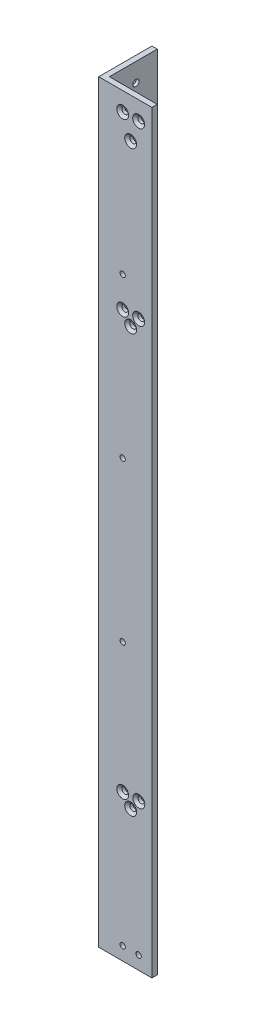
from build123d import *

# Parameters (mm, degrees)
BOSS_EXTRUDE1_DEPTH                               = 450
BACKSIDEHOLES_SKETCH3_R                           = 1.5875
BACKSIDEHOLES_CUT_EXTRUDE1_DEPTH                  = 3.175
RIGHTSIDEHOLES_CUT_EXTRUDE2_OUTLINE_R             = 1.5875
RIGHTSIDEHOLES_CUT_EXTRUDE2_DEPTH                 = 3.175
CSK_FOR_6_FLAT_HEAD_MACHINE_SCREW_100_D           = 3.7973
CSK_FOR_6_FLAT_HEAD_MACHINE_SCREW_100_CSINK_D     = 7.0866
CSK_FOR_6_FLAT_HEAD_MACHINE_SCREW_100_CSINK_ANGLE = 100
CSK_FOR_6_FLAT_HEAD_MACHINE_SCREW_2_D             = 3.7973
CSK_FOR_6_FLAT_HEAD_MACHINE_SCREW_2_CSINK_D       = 7.0866
CSK_FOR_6_FLAT_HEAD_MACHINE_SCREW_2_CSINK_ANGLE   = 100


# Read off the part's stored shape, not the designer's step: RightSideHoles-Cut-Extrude2
with BuildPart() as part:
    # Sketch2 → Boss-Extrude1 (new body)
    with BuildSketch(Plane(origin=(0, 0, 0), x_dir=(1, 0, 0), z_dir=(0, 1, 0))):
        Polygon((0, 31.75), (3.175, 31.75), (3.175, 3.175), (31.75, 3.175), (31.75, 0), (0, 0), align=None)
    extrude(amount=BOSS_EXTRUDE1_DEPTH)

    # BackSideHoles-Sketch3 → BackSideHoles-Cut-Extrude1 (cut)
    with BuildSketch(Plane.XY):
        with Locations((19.05, 81.1125)):
            Circle(BACKSIDEHOLES_SKETCH3_R)
        with Locations((14.2875, 87.4625)):
            Circle(BACKSIDEHOLES_SKETCH3_R)
        with Locations((23.933174186, 87.4625)):
            Circle(BACKSIDEHOLES_SKETCH3_R)
        with Locations((14.2875, 438.8875)):
            Circle(BACKSIDEHOLES_SKETCH3_R)
        with Locations((23.8125, 438.8875)):
            Circle(BACKSIDEHOLES_SKETCH3_R)
        with Locations((19.05, 426.1875)):
            Circle(BACKSIDEHOLES_SKETCH3_R)
        with Locations((14.2875, 336.74737)):
            Circle(BACKSIDEHOLES_SKETCH3_R)
        with Locations((23.8125, 336.74737)):
            Circle(BACKSIDEHOLES_SKETCH3_R)
        with Locations((19.05, 330.39737)):
            Circle(BACKSIDEHOLES_SKETCH3_R)
        with Locations((14.2875, 165)):
            Circle(BACKSIDEHOLES_SKETCH3_R)
        with Locations((14.2875, 260)):
            Circle(BACKSIDEHOLES_SKETCH3_R)
        with Locations((14.2875, 7.9375)):
            Circle(BACKSIDEHOLES_SKETCH3_R)
        with Locations((23.8125, 7.9375)):
            Circle(BACKSIDEHOLES_SKETCH3_R)
        with Locations((14.2875, 355)):
            Circle(BACKSIDEHOLES_SKETCH3_R)
    extrude(amount=-BACKSIDEHOLES_CUT_EXTRUDE1_DEPTH, mode=Mode.SUBTRACT)

    # RightSideHoles-Cut-Extrude2 outline → RightSideHoles-Cut-Extrude2 (cut)
    with BuildSketch(Plane.YZ):
        with Locations((81.1125, -23.8125)):
            Circle(RIGHTSIDEHOLES_CUT_EXTRUDE2_OUTLINE_R)
        with Locations((306.32237, -23.8125)):
            Circle(RIGHTSIDEHOLES_CUT_EXTRUDE2_OUTLINE_R)
        with Locations((341.24737, -14.2875)):
            Circle(RIGHTSIDEHOLES_CUT_EXTRUDE2_OUTLINE_R)
        with Locations((341.24737, -23.8125)):
            Circle(RIGHTSIDEHOLES_CUT_EXTRUDE2_OUTLINE_R)
        with Locations((165, -14.2875)):
            Circle(RIGHTSIDEHOLES_CUT_EXTRUDE2_OUTLINE_R)
        with Locations((306.32237, -14.2875)):
            Circle(RIGHTSIDEHOLES_CUT_EXTRUDE2_OUTLINE_R)
        with Locations((260, -14.2875)):
            Circle(RIGHTSIDEHOLES_CUT_EXTRUDE2_OUTLINE_R)
        with Locations((81.1125, -14.2875)):
            Circle(RIGHTSIDEHOLES_CUT_EXTRUDE2_OUTLINE_R)
        with Locations((87.4625, -19.05)):
            Circle(RIGHTSIDEHOLES_CUT_EXTRUDE2_OUTLINE_R)
        with Locations((355, -14.2875)):
            Circle(RIGHTSIDEHOLES_CUT_EXTRUDE2_OUTLINE_R)
        with Locations((438.8875, -19.05)):
            Circle(RIGHTSIDEHOLES_CUT_EXTRUDE2_OUTLINE_R)
        with Locations((426.1875, -14.2875)):
            Circle(RIGHTSIDEHOLES_CUT_EXTRUDE2_OUTLINE_R)
        with Locations((426.1875, -23.8125)):
            Circle(RIGHTSIDEHOLES_CUT_EXTRUDE2_OUTLINE_R)
        with Locations((7.9375, -23.8125)):
            Circle(RIGHTSIDEHOLES_CUT_EXTRUDE2_OUTLINE_R)
        with Locations((7.9375, -14.2875)):
            Circle(RIGHTSIDEHOLES_CUT_EXTRUDE2_OUTLINE_R)
    extrude(amount=RIGHTSIDEHOLES_CUT_EXTRUDE2_DEPTH, mode=Mode.SUBTRACT)

    # CSK for _6 Flat Head Machine Screw _100 (through all)
    with Locations(Plane.ZY):
        with Locations((-23.8125, 81.1125), (-19.05, 87.4625), (-14.2875, 81.1125), (-23.8125, 341.24737), (-14.2875, 341.24737), (-23.8125, 306.32237), (-14.2875, 306.32237), (-23.8125, 426.1875), (-14.2875, 426.1875), (-19.05, 438.8875)):
            CounterSinkHole(CSK_FOR_6_FLAT_HEAD_MACHINE_SCREW_100_D / 2, CSK_FOR_6_FLAT_HEAD_MACHINE_SCREW_100_CSINK_D / 2, counter_sink_angle=CSK_FOR_6_FLAT_HEAD_MACHINE_SCREW_100_CSINK_ANGLE)

    # CSK for _6 Flat Head Machine Screw _ 2 (through all)
    with Locations(Plane.XY):
        with Locations((14.2875, 336.74737), (23.8125, 336.74737), (19.05, 330.39737), (19.05, 426.1875), (23.8125, 438.8875), (14.2875, 438.8875), (14.2875, 87.4625), (23.933174186, 87.4625), (19.05, 81.1125)):
            CounterSinkHole(CSK_FOR_6_FLAT_HEAD_MACHINE_SCREW_2_D / 2, CSK_FOR_6_FLAT_HEAD_MACHINE_SCREW_2_CSINK_D / 2, counter_sink_angle=CSK_FOR_6_FLAT_HEAD_MACHINE_SCREW_2_CSINK_ANGLE)


solid = part.part
